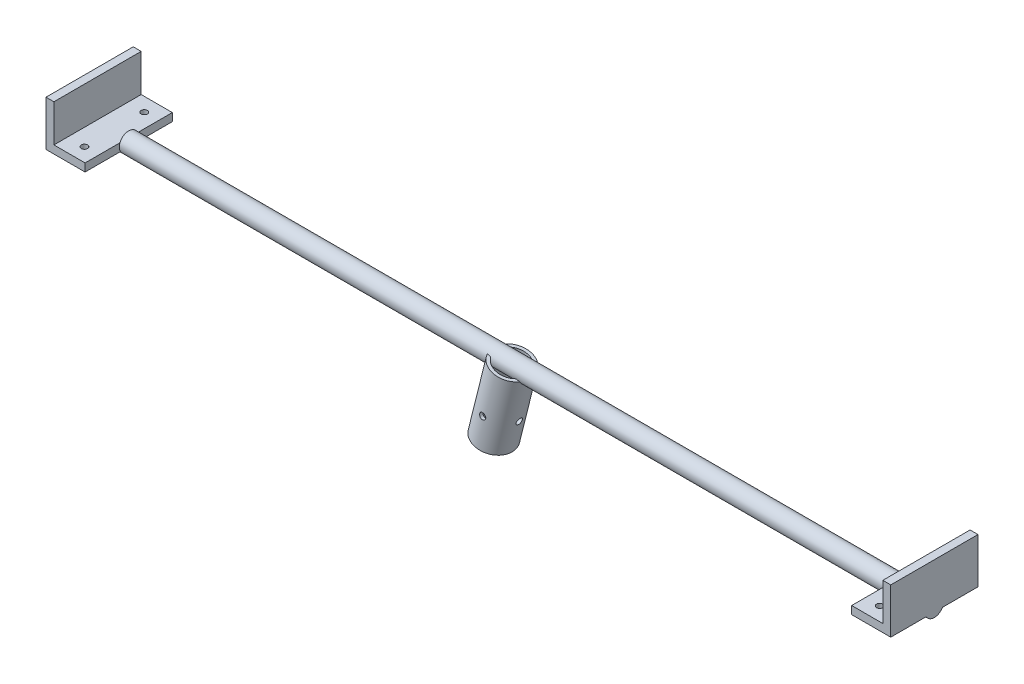
from build123d import *

# Parameters (mm, degrees)
SKETCH1_R                                = 7.5
BOSS_EXTRUDE1_DEPTH                      = 338.85
CUT_EXTRUDE3_START                       = -31.35
CUT_EXTRUDE3_DEPTH                       = 25
SKETCH5_W                                = 25
SKETCH5_H                                = 70
BOSS_EXTRUDE2_DEPTH                      = 6.35
BOSS_EXTRUDE3_START                      = -6.35
SKETCH6_W                                = 6.35
SKETCH6_H                                = 70
BOSS_EXTRUDE3_DEPTH                      = 36.35
F_8_0_199_DIAMETER_HOLE1_D               = 5.0546
F_8_0_199_DIAMETER_HOLE1_DEPTH           = 32.41
SKETCH10_R                               = 15
SKETCH10_R_2                             = 12.5
BOSS_EXTRUDE4_DEPTH                      = 60
F_8_0_199_DIAMETER_HOLE2_D               = 5.0546
F_8_0_199_DIAMETER_HOLE2_DEPTH           = 40
F_8_0_199_DIAMETER_HOLE2_ON_FACE_2_D     = 5.0546
F_8_0_199_DIAMETER_HOLE2_ON_FACE_2_DEPTH = 40


with BuildPart() as part:
    # Sketch1 → Boss-Extrude1 (new body)
    with BuildSketch(Plane(origin=(0, 0, 0), x_dir=(0, 0, -1), z_dir=(1, 0, 0))):
        Circle(SKETCH1_R)
    boss_extrude1 = extrude(amount=BOSS_EXTRUDE1_DEPTH)

    # Sketch4 → Cut-Extrude3 (cut)
    with BuildSketch(Plane(origin=(338.85, 0, 0), x_dir=(0, 0, -1), z_dir=(1, 0, 0)).offset(CUT_EXTRUDE3_START)):
        with BuildLine():
            Line((-7, 2.692582404), (7, 2.692582404))
            ThreePointArc((7, 2.692582404), (0, 7.5), (-7, 2.692582404))
        make_face()
    cut_extrude3 = extrude(amount=CUT_EXTRUDE3_DEPTH, mode=Mode.SUBTRACT)

    # Sketch5 → Boss-Extrude2 (add)
    with BuildSketch(Plane(origin=(0, 2.692582404, 0), x_dir=(1, 0, 0), z_dir=(0, 1, 0))):
        with Locations((320, -1e-09)):
            Rectangle(SKETCH5_W, SKETCH5_H)
    boss_extrude2 = extrude(amount=-BOSS_EXTRUDE2_DEPTH)

    # Sketch6 → Boss-Extrude3 (add)
    with BuildSketch(Plane(origin=(0, 2.692582404, 0), x_dir=(1, 0, 0), z_dir=(0, 1, 0)).offset(BOSS_EXTRUDE3_START)):
        with Locations((335.675, -1e-09)):
            Rectangle(SKETCH6_W, SKETCH6_H)
    boss_extrude3 = extrude(amount=BOSS_EXTRUDE3_DEPTH)

    # #8 (0.199) Diameter Hole1
    with Locations(Plane(origin=(0, -3.657417596, 0), x_dir=(-1, 0, 0), z_dir=(0, -1, 0))):
        with Locations((-319, 24), (-319, -24)):
            f_8_0_199_diameter_hole1 = Hole(F_8_0_199_DIAMETER_HOLE1_D / 2, depth=F_8_0_199_DIAMETER_HOLE1_DEPTH)

    # Mirror1: Boss-Extrude1, Cut-Extrude3, Boss-Extrude2, Boss-Extrude3, #8 (0.199) Diameter Hole1 across plane
    add(boss_extrude1.mirror(Plane(origin=(0, 0, 0), x_dir=(0, 0, 1), z_dir=(1, 0, 0))))
    add(cut_extrude3.mirror(Plane(origin=(0, 0, 0), x_dir=(0, 0, 1), z_dir=(1, 0, 0))), mode=Mode.SUBTRACT)
    add(boss_extrude2.mirror(Plane(origin=(0, 0, 0), x_dir=(0, 0, 1), z_dir=(1, 0, 0))))
    add(boss_extrude3.mirror(Plane(origin=(0, 0, 0), x_dir=(0, 0, 1), z_dir=(1, 0, 0))))
    add(f_8_0_199_diameter_hole1.mirror(Plane(origin=(0, 0, 0), x_dir=(0, 0, 1), z_dir=(1, 0, 0))), mode=Mode.SUBTRACT)

    # Sketch10 → Boss-Extrude4 (add)
    with BuildSketch(Plane(origin=(0, 0, 0), x_dir=(0.9702957262759956, -0.24192189559967145, 0), z_dir=(0.24192189559967145, 0.9702957262759956, 0))):
        Circle(SKETCH10_R)
        Circle(SKETCH10_R_2, mode=Mode.SUBTRACT)
    extrude(amount=-BOSS_EXTRUDE4_DEPTH)

    # #8 (0.199) Diameter Hole2
    with Locations(Plane(origin=(-8.696538443, -33.903186466, 14.998138771), x_dir=(0.999883178826, 0, 0.015284917456), z_dir=(-0.015284806463, 0.003810930269, 0.999875918053))):
        with Locations((0, 0)):
            Hole(F_8_0_199_DIAMETER_HOLE2_D / 2, depth=F_8_0_199_DIAMETER_HOLE2_DEPTH)

    # #8 (0.199) Diameter Hole2 on face 2
    with Locations(Plane(origin=(6.087169548, -37.589178854, 0), x_dir=(0.241921929637, 0.97029571779, 0), z_dir=(0.97029571779, -0.241921929637, 0))):
        with Locations((0, 0)):
            Hole(F_8_0_199_DIAMETER_HOLE2_ON_FACE_2_D / 2, depth=F_8_0_199_DIAMETER_HOLE2_ON_FACE_2_DEPTH)


solid = part.part
